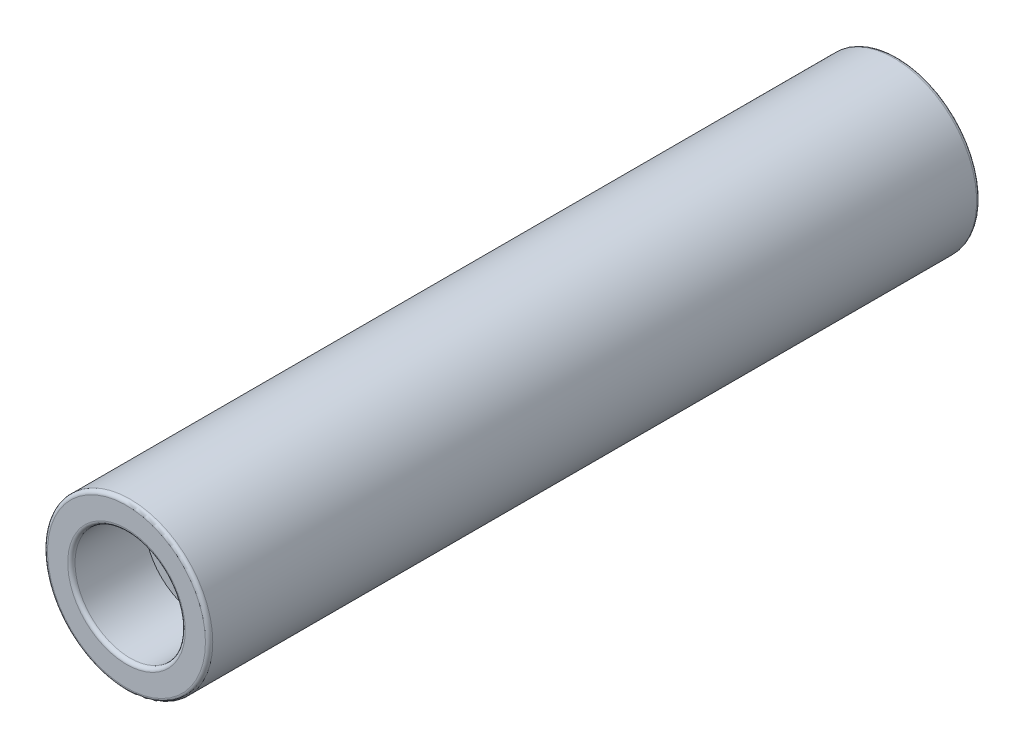
from build123d import *

# Parameters (mm, degrees)
SKETCH1_R           = 4.5
SKETCH1_R_2         = 2
EXTRUDE_THIN1_DEPTH = 12
SKETCH11_R          = 4.5
SKETCH11_R_2        = 1.5
EXTRUDE_THIN3_DEPTH = 5
SKETCH12_R          = 4.5
SKETCH12_R_2        = 3
EXTRUDE_THIN4_DEPTH = 4
THREAD1_PITCH       = 0.5
FILLET2_R           = 0.2


# Read off the part's stored shape, not the designer's step: Revolve1
with BuildPart() as part:
    # Sketch1 → Extrude-Thin1 (new body)
    with BuildSketch(Plane.XY):
        Circle(SKETCH1_R)
        Circle(SKETCH1_R_2, mode=Mode.SUBTRACT)
    extrude_thin1 = extrude(amount=EXTRUDE_THIN1_DEPTH)

    # Sketch11 → Extrude-Thin3 (add)
    with BuildSketch(Plane.XY.offset(12)):
        Circle(SKETCH11_R)
        Circle(SKETCH11_R_2, mode=Mode.SUBTRACT)
    extrude_thin3 = extrude(amount=EXTRUDE_THIN3_DEPTH)

    # Sketch12 → Extrude-Thin4 (add)
    with BuildSketch(Plane.XY.offset(17)):
        Circle(SKETCH12_R)
        Circle(SKETCH12_R_2, mode=Mode.SUBTRACT)
    extrude_thin4 = extrude(amount=EXTRUDE_THIN4_DEPTH)

    # Thread1: the profile of Thread Profile1 profile screwed along a right-hand helix of 10 turns, 6 arcs to a turn; built about Z, then put on its axis
    thread1_z = Axis((0, 0, 0), (0, 0, 1))
    thread1_corners = [(1.5003, 0, -0.000173205), (1.5003, 0, 0.437673204), (1.229367063, 0, 0.281249999), (1.229367063, 0, 0.156249999)]
    with BuildLine(mode=Mode.PRIVATE) as thread1_profile:
        Line(thread1_corners[0], thread1_corners[1])
        Line(thread1_corners[1], thread1_corners[2])
        Line(thread1_corners[2], thread1_corners[3])
        Line(thread1_corners[3], thread1_corners[0])
    thread1_cap = Face(thread1_profile.wire())
    thread1_turn_angles = [0, 30, 60, 90, 120, 150, 180, 210, 240, 270, 300, 330, 360]
    thread1_turn_weights = [1, 0.8660254037844387, 1, 0.8660254037844387, 1, 0.8660254037844387, 1, 0.8660254037844387, 1, 0.8660254037844387, 1, 0.8660254037844387, 1]
    thread1_turn_rails = [Edge.make_bspline([Vector(p[0], p[1], 0).rotate(thread1_z, thread1_turn_angles[k]) / thread1_turn_weights[k] + Vector(0, 0, p[2] + THREAD1_PITCH * thread1_turn_angles[k] / 360) for k in range(13)], [0, 0, 0, 1, 1, 2, 2, 3, 3, 4, 4, 5, 5, 6, 6, 6], 2, thread1_turn_weights) for p in thread1_corners]
    thread1_turn_sides = [Face.make_surface_from_curves(thread1_turn_rails[p[0]], thread1_turn_rails[p[1]]) for p in [(0, 1), (1, 2), (2, 3), (3, 0)]]
    thread1 = Plane(origin=(0, 0, 12), x_dir=(1, 0, 0), z_dir=(0, 0, 1)) * Solid(Shell([*[p.moved(Location((0, 0, THREAD1_PITCH * i))) for i in range(10) for p in thread1_turn_sides], thread1_cap, thread1_cap.rotate(thread1_z, 3600).moved(Location((0, 0, THREAD1_PITCH * 3600 / 360)))]))
    add(thread1)

    # Mirror2: Extrude-Thin1, Extrude-Thin3, Extrude-Thin4, Thread1 across plane
    add(extrude_thin1.mirror(Plane.XY))
    add(extrude_thin3.mirror(Plane.XY))
    add(extrude_thin4.mirror(Plane.XY))
    add(thread1.mirror(Plane.XY))

    # Fillet2
    fillet2_edges = [part.edges().sort_by_distance(p)[0] for p in [
        (-4.5, 0, 21),
        (-3, 0, 21),
        (-4.5, 0, -21),
        (-3, 0, -21),
    ]]
    fillet(fillet2_edges, radius=FILLET2_R)

    # Revolve1 outline → Revolve1 (revolve)
    with BuildSketch(Plane.XZ):
        Polygon((2, 12), (1.5, 12), (2, 11.5), align=None)
    revolve1 = revolve(axis=Axis((0, 0, 0), (0, 0, 1)))

    # Mirror3: Revolve1 across plane
    add(revolve1.mirror(Plane.XY))


solid = part.part
